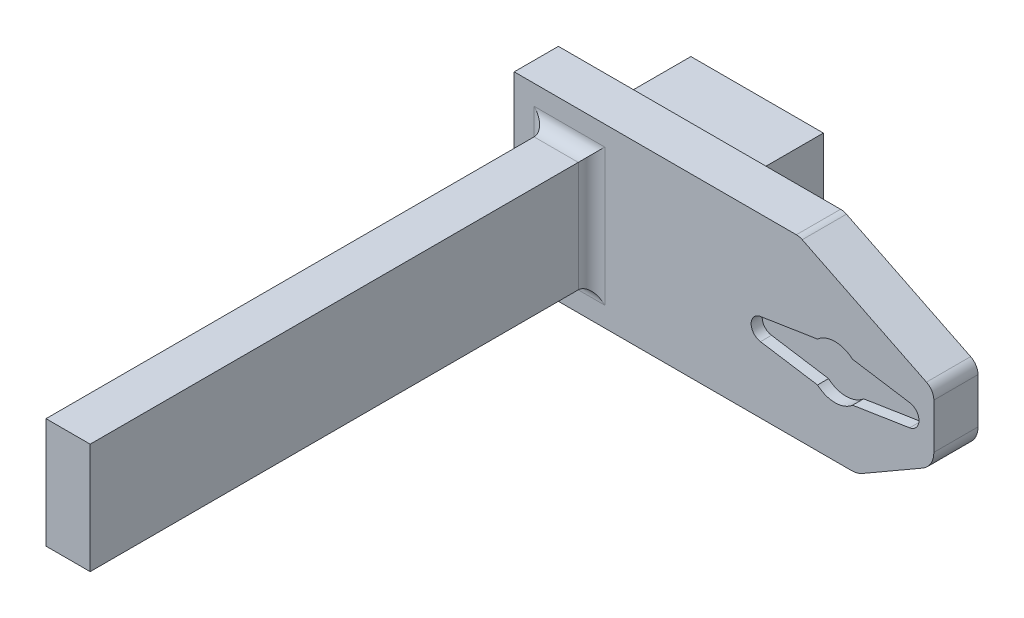
from build123d import *

# Parameters (mm, degrees)
SKETCH3_W            = 45
SKETCH3_H            = 15
BOSS_EXTRUDE1_DEPTH  = 10
CUT_EXTRUDE1_DEPTH   = 2.5
SKETCH11_W           = 45
SKETCH11_H           = 10
BOSS_EXTRUDE5_DEPTH  = 10
SKETCH14_W           = 45
SKETCH14_H           = 10
BOSS_EXTRUDE7_DEPTH  = 15
SKETCH20_W           = 10
SKETCH20_H           = 40
BOSS_EXTRUDE10_DEPTH = 50
SKETCH21_W           = 10
SKETCH21_H           = 25
BOSS_EXTRUDE11_DEPTH = 113.5
SKETCH22_W           = 30
SKETCH22_H           = 6
BOSS_EXTRUDE12_DEPTH = 30
SKETCH23_W           = 30
SKETCH23_H           = 30
BOSS_EXTRUDE13_DEPTH = 8.5
FILLET1_R            = 3
CHAMFER1_SIZE        = 15
CHAMFER1_SIZE2       = 30.41699103
FILLET2_R            = 3
CHAMFER2_SIZE        = 10
CHAMFER2_SIZE2       = 17.320508076
FILLET3_R            = 5


with BuildPart() as part:
    # Sketch3 → Boss-Extrude1 (new body)
    with BuildSketch(Plane.XY):
        with Locations((-0.138845539, 0.05888455)):
            Rectangle(SKETCH3_W, SKETCH3_H)
    extrude(amount=-BOSS_EXTRUDE1_DEPTH)

    # Sketch2 → Cut-Extrude1 (cut)
    with BuildSketch(Plane.XY):
        with BuildLine():
            Line((-16.888114198, 2.469689731), (-3.968626967, 4.5))
            ThreePointArc((-3.968626967, 4.5), (0, 6), (3.968626967, 4.5))
            Line((3.968626967, 4.5), (16.888114198, 2.469689731))
            ThreePointArc((16.888114198, 2.469689731), (19, 0), (16.888114198, -2.469689731))
            Line((16.888114198, -2.469689731), (3.968626967, -4.5))
            ThreePointArc((3.968626967, -4.5), (0, -6), (-3.968626967, -4.5))
            Line((-3.968626967, -4.5), (-16.888114198, -2.469689731))
            ThreePointArc((-16.888114198, -2.469689731), (-19, 0), (-16.888114198, 2.469689731))
        make_face()
    extrude(amount=-CUT_EXTRUDE1_DEPTH, mode=Mode.SUBTRACT)

    # Sketch11 → Boss-Extrude5 (add)
    with BuildSketch(Plane.XZ.offset(7.44111545)):
        with Locations((-0.138845539, -5)):
            Rectangle(SKETCH11_W, SKETCH11_H)
    extrude(amount=BOSS_EXTRUDE5_DEPTH)

    # Sketch14 → Boss-Extrude7 (add)
    with BuildSketch(Plane(origin=(0, 7.55888455, 0), x_dir=(1, 0, 0), z_dir=(0, 1, 0))):
        with Locations((-0.138845539, 5)):
            Rectangle(SKETCH14_W, SKETCH14_H)
    extrude(amount=BOSS_EXTRUDE7_DEPTH)

    # Sketch20 → Boss-Extrude10 (add)
    with BuildSketch(Plane.ZY.offset(22.638845539)):
        with Locations((-5, 2.55888455)):
            Rectangle(SKETCH20_W, SKETCH20_H)
    extrude(amount=BOSS_EXTRUDE10_DEPTH)

    # Sketch21 → Boss-Extrude11 (add)
    with BuildSketch(Plane.XY):
        with Locations((-60.138845539, 2.55888455)):
            Rectangle(SKETCH21_W, SKETCH21_H)
    extrude(amount=BOSS_EXTRUDE11_DEPTH)

    # Sketch22 → Boss-Extrude12 (add)
    with BuildSketch(Plane(origin=(0, 0, -10), x_dir=(-1, 0, 0), z_dir=(0, 0, -1))):
        with Locations((57.638845539, 2.55888455)):
            Rectangle(SKETCH22_W, SKETCH22_H)
    extrude(amount=BOSS_EXTRUDE12_DEPTH)

    # Sketch23 → Boss-Extrude13 (add)
    with BuildSketch(Plane.XZ.offset(0.44111545)):
        with Locations((-57.638845539, -25)):
            Rectangle(SKETCH23_W, SKETCH23_H)
    extrude(amount=BOSS_EXTRUDE13_DEPTH)

    # Fillet1
    fillet1_edges = [part.edges().sort_by_distance(p)[0] for p in [
        (-60.138845539, 15.05888455, 0),
        (-65.138845539, 2.55888455, 0),
        (-55.138845539, 2.55888455, 0),
        (-60.138845539, -9.94111545, 0),
    ]]
    fillet(fillet1_edges, radius=FILLET1_R)

    # Chamfer1
    chamfer1_edges = [part.edges().sort_by_distance(p)[0] for p in [
        (22.361154461, 22.55888455, -5),
    ]]
    chamfer1_side = [part.faces().sort_by_distance(p)[0] for p in [
        (22.361154461, 2.55888455, -5),
    ]]
    chamfer(chamfer1_edges, length=CHAMFER1_SIZE, length2=CHAMFER1_SIZE2, reference=chamfer1_side[0])

    # Fillet2
    fillet2_edges = [part.edges().sort_by_distance(p)[0] for p in [
        (-8.055836569, 22.55888455, -5),
        (22.361154461, 7.55888455, -5),
    ]]
    fillet(fillet2_edges, radius=FILLET2_R)

    # Chamfer2
    chamfer2_edges = [part.edges().sort_by_distance(p)[0] for p in [
        (22.361154461, -17.44111545, -5),
    ]]
    chamfer2_side = [part.faces().sort_by_distance(p)[0] for p in [
        (22.361154461, -5.873875391, -5),
    ]]
    chamfer(chamfer2_edges, length=CHAMFER2_SIZE, length2=CHAMFER2_SIZE2, reference=chamfer2_side[0])

    # Fillet3
    fillet3_edges = [part.edges().sort_by_distance(p)[0] for p in [
        (5.040646385, -17.44111545, -5),
        (22.361154461, -7.44111545, -5),
    ]]
    fillet(fillet3_edges, radius=FILLET3_R)


solid = part.part
